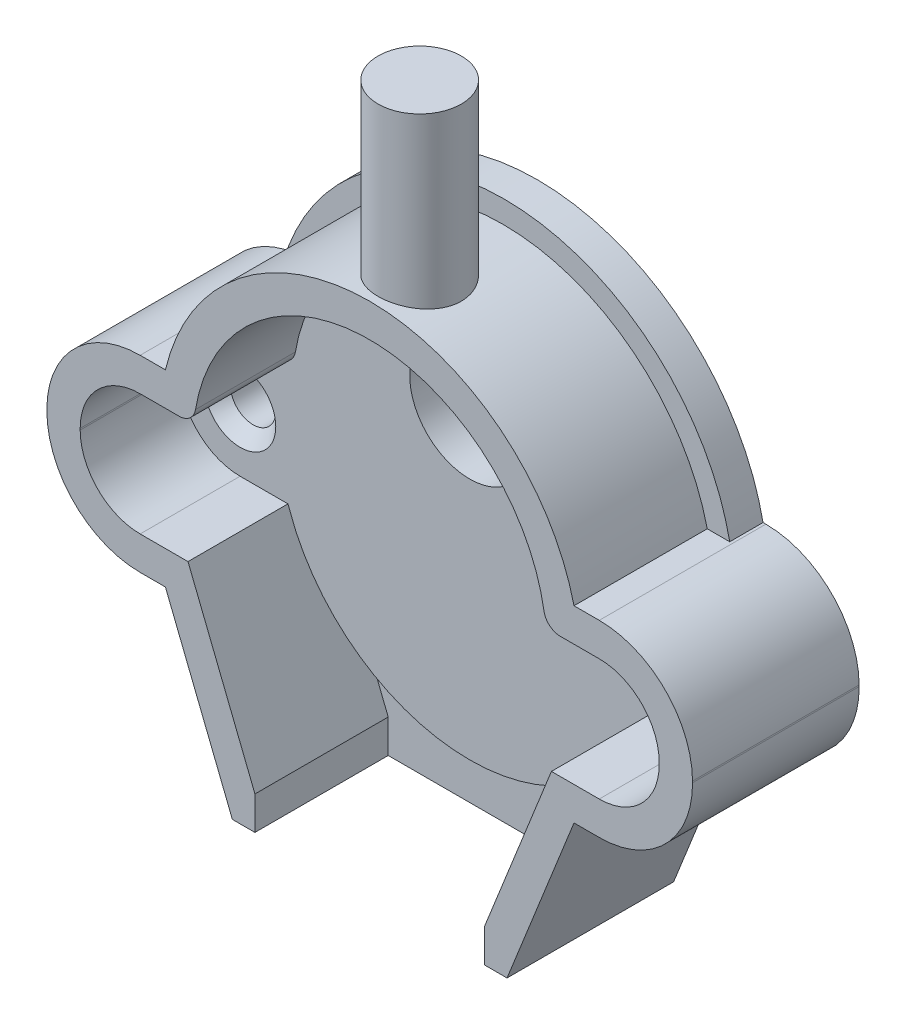
from build123d import *

# Parameters (mm, degrees)
BOSS_EXTRUDE1_DEPTH             = 12.7
SHELL1_START                    = 2.54
SHELL1_DEPTH                    = 10.16
BOSS_EXTRUDE7_DEPTH             = 2.54
SKETCH7_W                       = 17.498012995
SKETCH7_H                       = 10.16
CUT_EXTRUDE5_DEPTH              = 48.524856948
SKETCH13_R                      = 4.572
BOSS_EXTRUDE3_DEPTH             = 2.54
CUT_EXTRUDE7_DEPTH              = 34.365857316
CUT_EXTRUDE7_DEPTH_BACK         = 34.365857316
SKETCH14_R                      = 2.667
F_8_32_TAPPED_HOLE1_D           = 3.4544
F_8_32_TAPPED_HOLE1_CSINK_D     = 5.4356
F_8_32_TAPPED_HOLE1_CSINK_ANGLE = 90
BOSS_EXTRUDE4_DEPTH             = 12.7
BOSS_EXTRUDE4_DEPTH_BACK        = 1.27
SKETCH18_R                      = 3.175
SKETCH19_R                      = 3.937
CUT_EXTRUDE8_DEPTH              = 2.54
FILLET1_R                       = 1.27


# Read off the part's stored shape, not the designer's step: Shell1
with BuildPart() as part:
    # Sketch1 → Boss-Extrude1 (new body)
    with BuildSketch(Plane.XY):
        with BuildLine():
            Line((17.500007037, 7.168559726), (15.574433037, 7.168559726))
            ThreePointArc((15.574433037, 7.168559726), (0, 19.486736174), (-15.574433037, 7.168559726))
            Line((-15.574433037, 7.168559726), (-17.500007037, 7.168559726))
            ThreePointArc((-17.500007037, 7.168559726), (-22.528950465, 5.085503154), (-24.612007037, 0.056559726))
            Line((-24.612007037, 0.056559726), (-24.612007037, -0.056559726))
            ThreePointArc((-24.612007037, -0.056559726), (-22.528950465, -5.085503154), (-17.500007037, -7.168559726))
            Line((-17.500007037, -7.168559726), (-15.574433037, -7.168559726))
            Line((-15.574433037, -7.168559726), (-10.470235042, -19.960271007))
            Line((-10.470235042, -19.960271007), (10.470222973, -19.960271007))
            Line((10.470222973, -19.960271007), (15.574433037, -7.168559726))
            Line((15.574433037, -7.168559726), (17.500007037, -7.168559726))
            ThreePointArc((17.500007037, -7.168559726), (22.548907748, -5.065466355), (24.611782132, 0))
            Line((24.611782132, 0), (24.611782132, 0.113119452))
            ThreePointArc((24.611782132, 0.113119452), (22.508913666, 5.105460437), (17.500007037, 7.168559726))
        make_face()
    extrude(amount=BOSS_EXTRUDE1_DEPTH)

    # Shell1 outline → Shell1 (cut)
    with BuildSketch(Plane.XY.offset(SHELL1_START)):
        with BuildLine():
            ThreePointArc((13.415909513, 4.628559726), (0, 16.946736174), (-13.415909513, 4.628559726))
            Line((-13.415909513, 4.628559726), (-17.500007037, 4.628559726))
            ThreePointArc((-17.500007037, 4.628559726), (-20.732899241, 3.28945193), (-22.072007037, 0.056559726))
            Line((-22.072007037, 0.056559726), (-22.072007037, -0.056559726))
            ThreePointArc((-22.072007037, -0.056559726), (-20.732899241, -3.28945193), (-17.500007037, -4.628559726))
            Line((-17.500007037, -4.628559726), (-13.853209773, -4.628559726))
            Line((-13.853209773, -4.628559726), (-8.749011778, -17.420271007))
            Line((-8.749011778, -17.420271007), (8.749001217, -17.420271007))
            Line((8.749001217, -17.420271007), (13.853211281, -4.628559726))
            Line((13.853211281, -4.628559726), (17.500007037, -4.628559726))
            ThreePointArc((17.500007037, -4.628559726), (20.748892784, -3.273378869), (22.071782132, -0.011211257))
            Line((22.071782132, -0.011211257), (22.071782132, 0.101908195))
            ThreePointArc((22.071782132, 0.101908195), (20.71682618, 3.305445473), (17.500007037, 4.628559726))
            Line((17.500007037, 4.628559726), (13.415909513, 4.628559726))
        make_face()
    extrude(amount=SHELL1_DEPTH, mode=Mode.SUBTRACT)

    # Sketch22 → Boss-Extrude7 (add)
    with BuildSketch(Plane(origin=(0, 0, 0), x_dir=(-1, 0, 0), z_dir=(0, 0, -1))):
        with BuildLine():
            Line((-17.28751812, 7.168559726), (17.136892248, 7.168559726))
            ThreePointArc((17.136892248, 7.168559726), (-0.075312936, 21.200593012), (-17.28751812, 7.168559726))
        make_face()
    extrude(amount=-BOSS_EXTRUDE7_DEPTH)

    # Sketch7 → Cut-Extrude5 (cut, through all)
    with BuildSketch(Plane(origin=(0, -17.420271007, 0), x_dir=(1, 0, 0), z_dir=(0, 1, 0))):
        with Locations((-5.28e-06, -7.62)):
            Rectangle(SKETCH7_W, SKETCH7_H)
    extrude(amount=-CUT_EXTRUDE5_DEPTH, mode=Mode.SUBTRACT)

    # Sketch13 → Boss-Extrude3 (add)
    with BuildSketch(Plane.XY.offset(2.54)):
        with BuildLine():
            Line((-17.500007037, -4.628559726), (-13.852164447, -4.628559726))
            ThreePointArc((-13.852164447, -4.628559726), (0, -14.605), (13.852164447, -4.628559726))
            Line((13.852164447, -4.628559726), (16.51, -4.628559726))
            ThreePointArc((16.51, -4.628559726), (21.991424378, -1.364408419), (19.119271672, 4.332207752))
            ThreePointArc((19.119271672, 4.332207752), (18.323086992, 4.553861516), (17.500007037, 4.628559726))
            Line((17.500007037, 4.628559726), (13.415909513, 4.628559726))
            ThreePointArc((13.415909513, 4.628559726), (0, 16.946736174), (-13.415909513, 4.628559726))
            Line((-13.415909513, 4.628559726), (-16.51, 4.628559726))
            ThreePointArc((-16.51, 4.628559726), (-21.991424378, 1.364408419), (-19.119271672, -4.332207752))
            ThreePointArc((-19.119271672, -4.332207752), (-18.323086992, -4.553861516), (-17.500007037, -4.628559726))
        make_face()
        with Locations((0, 8.509)):
            Circle(SKETCH13_R, mode=Mode.SUBTRACT)
    extrude(amount=BOSS_EXTRUDE3_DEPTH)

    # Sketch14 → Cut-Extrude7 (cut, two sides: drawn at the far end of the back side and taken through both)
    with BuildSketch(Plane.XY.offset(5.08).offset(-CUT_EXTRUDE7_DEPTH_BACK)):
        with Locations((0, 8.50001094)):
            Circle(SKETCH14_R)
    extrude(amount=CUT_EXTRUDE7_DEPTH + CUT_EXTRUDE7_DEPTH_BACK, mode=Mode.SUBTRACT)

    # #8-32 Tapped Hole1 (through all)
    with Locations(Plane.XY.offset(5.08)):
        with Locations((-17.500007037, 0), (17.500007037, 0)):
            CounterSinkHole(F_8_32_TAPPED_HOLE1_D / 2, F_8_32_TAPPED_HOLE1_CSINK_D / 2, counter_sink_angle=F_8_32_TAPPED_HOLE1_CSINK_ANGLE)

    # Sketch18 → Boss-Extrude4 (add, two sides: drawn at the far end of the back side and taken through both)
    with BuildSketch(Plane(origin=(0, 19.486736174, 0), x_dir=(1, 0, 0), z_dir=(0, 1, 0)).offset(-BOSS_EXTRUDE4_DEPTH_BACK)):
        with Locations(Location((0, -8.89, 0), (0, 0, 270))):
            Circle(SKETCH18_R)
    extrude(amount=BOSS_EXTRUDE4_DEPTH + BOSS_EXTRUDE4_DEPTH_BACK)

    # Sketch19 → Cut-Extrude8 (cut)
    with BuildSketch(Plane(origin=(0, 0, 0), x_dir=(-1, 0, 0), z_dir=(0, 0, -1))):
        with Locations((0, 8.50001094)):
            Circle(SKETCH19_R)
    extrude(amount=-CUT_EXTRUDE8_DEPTH, mode=Mode.SUBTRACT)

    # Fillet1
    fillet1_edges = [part.edges().sort_by_distance(p)[0] for p in [
        (13.415909513, 4.628559726, 8.89),
        (-13.415909513, 4.628559726, 8.89),
    ]]
    fillet(fillet1_edges, radius=FILLET1_R)


solid = part.part
